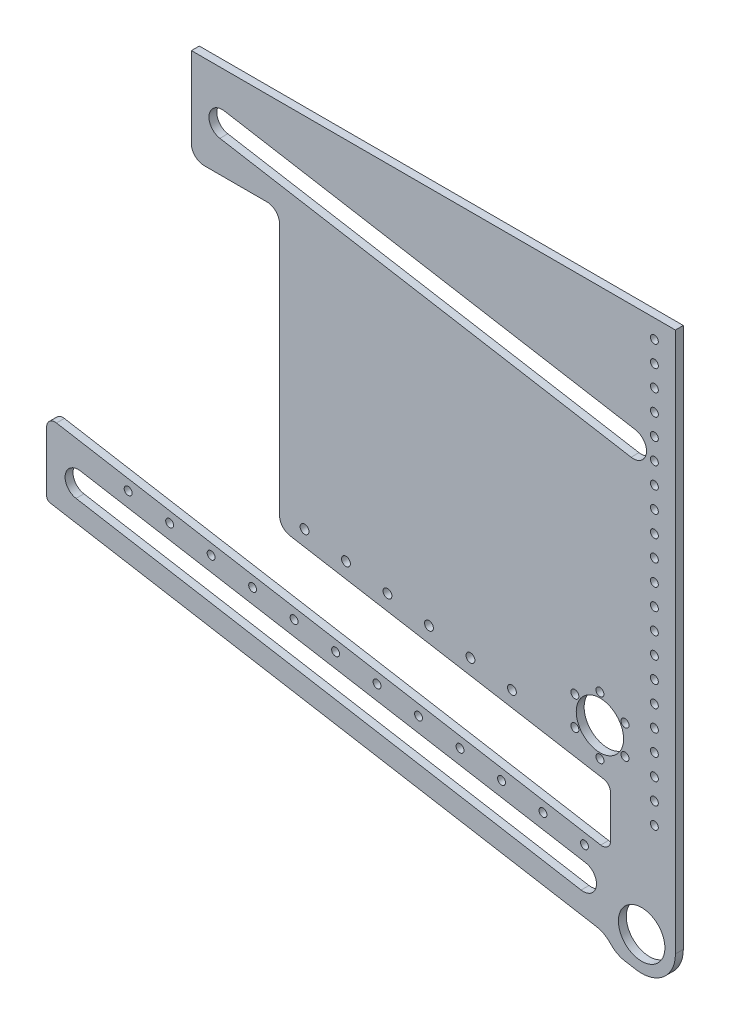
from build123d import *

# Parameters (mm, degrees)
SKETCH1_R           = 14.0335
SKETCH1_R_2         = 2.38125
SKETCH1_R_3         = 14.2875
SKETCH1_R_4         = 2.413
SKETCH1_R_5         = 2.667
BOSS_EXTRUDE1_DEPTH = 4.7625


with BuildPart() as part:
    # Sketch1 → Boss-Extrude1 (new body)
    with BuildSketch(Plane.XY):
        with BuildLine():
            Line((165.542350471, -12.850928795), (158.864493489, -11.70515089))
            ThreePointArc((158.864493489, -11.70515089), (154.154566121, -10.06953751), (150.224583517, -7.001332225))
            ThreePointArc((150.224583517, -7.001332225), (146.294597206, -3.933124046), (141.584665397, -2.297509122))
            Line((141.584665397, -2.297509122), (-187.947182678, 54.243131298))
            ThreePointArc((-187.947182678, 54.243131298), (-189.459634879, 55.109389206), (-190.057649529, 56.746549217))
            Line((-190.057649529, 56.746549217), (-190.057649529, 92.982130912))
            ThreePointArc((-190.057649529, 92.982130912), (-188.265613802, 96.836753181), (-184.163460571, 97.951133618))
            Line((-184.163460571, 97.951133618), (139.126757829, 42.481423795))
            Line((139.126757829, 42.481423795), (144.285517219, 41.596290654))
            ThreePointArc((144.285517219, 41.596290654), (148.418903539, 42.719155791), (150.224583517, 46.603126491))
            Line((150.224583517, 46.603126491), (150.224583517, 72.003126491))
            ThreePointArc((150.224583517, 72.003126491), (149.028554217, 75.277446512), (146.003649815, 77.009962327))
            Line((146.003649815, 77.009962327), (-43.218335812, 109.476421371))
            ThreePointArc((-43.218335812, 109.476421371), (-47.755692415, 112.075195094), (-49.549736366, 116.986675126))
            Line((-49.549736366, 116.986675126), (-49.549736366, 269.386675126))
            ThreePointArc((-49.549736366, 269.386675126), (-51.781582693, 274.774828799), (-57.169736366, 277.006675126))
            Line((-57.169736366, 277.006675126), (-95.10714601, 277.006675126))
            ThreePointArc((-95.10714601, 277.006675126), (-100.495299682, 279.238521453), (-102.72714601, 284.626675126))
            Line((-102.72714601, 284.626675126), (-102.72714601, 333.30748602))
            Line((-102.72714601, 333.30748602), (189.37285399, 333.30748602))
            Line((189.37285399, 333.30748602), (189.37285399, 131.560051298))
            Line((189.37285399, 131.560051298), (189.37285399, 7.239))
            ThreePointArc((189.37285399, 7.239), (182.127563077, -8.345432433), (165.542350471, -12.850928795))
        make_face()
        with Locations((168.98935399, 7.239)):
            Circle(SKETCH1_R, mode=Mode.SUBTRACT)
        with Locations((176.67285399, 118.860051298)):
            Circle(SKETCH1_R_2, mode=Mode.SUBTRACT)
        with Locations((176.67285399, 106.160051298)):
            Circle(SKETCH1_R_2, mode=Mode.SUBTRACT)
        with Locations((176.67285399, 93.460051298)):
            Circle(SKETCH1_R_2, mode=Mode.SUBTRACT)
        with Locations((176.67285399, 80.760051298)):
            Circle(SKETCH1_R_2, mode=Mode.SUBTRACT)
        with Locations((176.67285399, 68.060051298)):
            Circle(SKETCH1_R_2, mode=Mode.SUBTRACT)
        with Locations((109.44968796, 41.130584726)):
            Circle(SKETCH1_R_2, mode=Mode.SUBTRACT)
        with Locations((84.415508776, 45.425916214)):
            Circle(SKETCH1_R_2, mode=Mode.SUBTRACT)
        with Locations((59.381329592, 49.721247702)):
            Circle(SKETCH1_R_2, mode=Mode.SUBTRACT)
        with Locations((34.347150409, 54.016579191)):
            Circle(SKETCH1_R_2, mode=Mode.SUBTRACT)
        with Locations((9.312971225, 58.311910679)):
            Circle(SKETCH1_R_2, mode=Mode.SUBTRACT)
        with Locations((-15.721207959, 62.607242167)):
            Circle(SKETCH1_R_2, mode=Mode.SUBTRACT)
        with Locations((-40.755387143, 66.902573656)):
            Circle(SKETCH1_R_2, mode=Mode.SUBTRACT)
        with Locations((-65.789566327, 71.197905144)):
            Circle(SKETCH1_R_2, mode=Mode.SUBTRACT)
        with Locations((-90.82374551, 75.493236632)):
            Circle(SKETCH1_R_2, mode=Mode.SUBTRACT)
        with Locations((-115.857924694, 79.788568121)):
            Circle(SKETCH1_R_2, mode=Mode.SUBTRACT)
        with Locations((-140.892103878, 84.083899609)):
            Circle(SKETCH1_R_2, mode=Mode.SUBTRACT)
        with Locations((134.483867144, 36.835253237)):
            Circle(SKETCH1_R_2, mode=Mode.SUBTRACT)
        with Locations((143.80981943, 103.921008836)):
            Circle(SKETCH1_R_3, mode=Mode.SUBTRACT)
        with Locations((143.80981943, 121.383508836)):
            Circle(SKETCH1_R_4, mode=Mode.SUBTRACT)
        with Locations((158.932788044, 112.652258836)):
            Circle(SKETCH1_R_4, mode=Mode.SUBTRACT)
        with Locations((158.932788044, 95.189758836)):
            Circle(SKETCH1_R_4, mode=Mode.SUBTRACT)
        with Locations((143.80981943, 86.458508836)):
            Circle(SKETCH1_R_4, mode=Mode.SUBTRACT)
        with Locations((128.686850817, 95.189758836)):
            Circle(SKETCH1_R_4, mode=Mode.SUBTRACT)
        with Locations((128.686850817, 112.652258836)):
            Circle(SKETCH1_R_4, mode=Mode.SUBTRACT)
        with Locations((176.67285399, 131.560051298)):
            Circle(SKETCH1_R_2, mode=Mode.SUBTRACT)
        with Locations((176.67285399, 144.260051298)):
            Circle(SKETCH1_R_2, mode=Mode.SUBTRACT)
        with Locations((176.67285399, 156.960051298)):
            Circle(SKETCH1_R_2, mode=Mode.SUBTRACT)
        with Locations((176.67285399, 169.660051298)):
            Circle(SKETCH1_R_2, mode=Mode.SUBTRACT)
        with Locations((176.67285399, 182.360051298)):
            Circle(SKETCH1_R_2, mode=Mode.SUBTRACT)
        with Locations((176.67285399, 195.060051298)):
            Circle(SKETCH1_R_2, mode=Mode.SUBTRACT)
        with Locations((176.67285399, 207.760051298)):
            Circle(SKETCH1_R_2, mode=Mode.SUBTRACT)
        with Locations((176.67285399, 220.460051298)):
            Circle(SKETCH1_R_2, mode=Mode.SUBTRACT)
        with Locations((176.67285399, 233.160051298)):
            Circle(SKETCH1_R_2, mode=Mode.SUBTRACT)
        with Locations((176.67285399, 245.860051298)):
            Circle(SKETCH1_R_2, mode=Mode.SUBTRACT)
        with Locations((176.67285399, 258.560051298)):
            Circle(SKETCH1_R_2, mode=Mode.SUBTRACT)
        with Locations((176.67285399, 271.260051298)):
            Circle(SKETCH1_R_2, mode=Mode.SUBTRACT)
        with Locations((176.67285399, 283.960051298)):
            Circle(SKETCH1_R_2, mode=Mode.SUBTRACT)
        with Locations((176.67285399, 296.660051298)):
            Circle(SKETCH1_R_2, mode=Mode.SUBTRACT)
        with Locations((176.67285399, 309.360051298)):
            Circle(SKETCH1_R_2, mode=Mode.SUBTRACT)
        with Locations((176.67285399, 322.060051298)):
            Circle(SKETCH1_R_2, mode=Mode.SUBTRACT)
        with Locations((-9.432735227, 113.017786349)):
            Circle(SKETCH1_R_5, mode=Mode.SUBTRACT)
        with Locations((15.601656952, 108.723696433)):
            Circle(SKETCH1_R_5, mode=Mode.SUBTRACT)
        with Locations((40.636049132, 104.429606517)):
            Circle(SKETCH1_R_5, mode=Mode.SUBTRACT)
        with Locations((65.670441311, 100.135516602)):
            Circle(SKETCH1_R_5, mode=Mode.SUBTRACT)
        with Locations((90.704833491, 95.841426686)):
            Circle(SKETCH1_R_5, mode=Mode.SUBTRACT)
        with Locations((-34.467127407, 117.311876264)):
            Circle(SKETCH1_R_5, mode=Mode.SUBTRACT)
        with BuildLine():
            Line((132.450059381, 12.155377797), (-172.349940619, 64.452560302))
            ThreePointArc((-172.349940619, 64.452560302), (-178.830830524, 73.618032387), (-169.665358439, 80.098922292))
            Line((-169.665358439, 80.098922292), (135.134641561, 27.801739787))
            ThreePointArc((135.134641561, 27.801739787), (141.615531466, 18.636267702), (132.450059381, 12.155377797))
        make_face(mode=Mode.SUBTRACT)
        with BuildLine():
            Line((162.6305629, 253.455377797), (-85.5274371, 296.034000553))
            ThreePointArc((-85.5274371, 296.034000553), (-92.008327005, 305.199472638), (-82.84285492, 311.680362543))
            Line((-82.84285492, 311.680362543), (165.31514508, 269.101739787))
            ThreePointArc((165.31514508, 269.101739787), (171.796034985, 259.936267702), (162.6305629, 253.455377797))
        make_face(mode=Mode.SUBTRACT)
    extrude(amount=BOSS_EXTRUDE1_DEPTH)


solid = part.part
